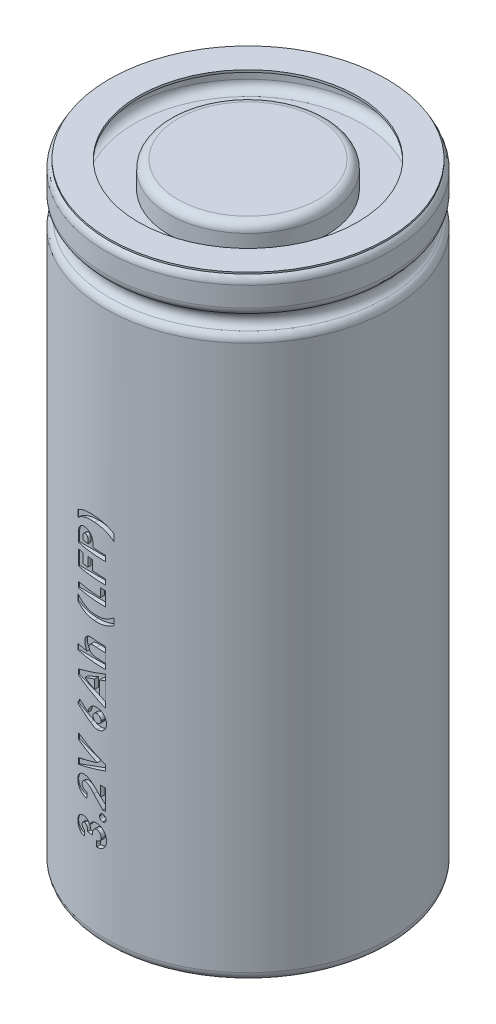
from build123d import *

# Parameters (mm, degrees)
SKETCH2_R           = 16.25
BOSS_EXTRUDE1_DEPTH = 70
SKETCH3_R           = 14
CUT_EXTRUDE1_DEPTH  = 3
SKETCH4_R           = 9
BOSS_EXTRUDE2_DEPTH = 3
SKETCH5_R           = 1
FILLET1_R           = 1
SKETCH6_R           = 15.833163787
SKETCH6_R_2         = 12.5
BOSS_EXTRUDE3_DEPTH = 0.25
CUT_EXTRUDE2_DEPTH  = 0.5


with BuildPart() as part:
    # Sketch2 → Boss-Extrude1 (new body)
    with BuildSketch(Plane(origin=(0, 0, 0), x_dir=(1, 0, 0), z_dir=(0, 1, 0))):
        Circle(SKETCH2_R)
    extrude(amount=BOSS_EXTRUDE1_DEPTH)

    # Sketch3 → Cut-Extrude1 (cut)
    with BuildSketch(Plane(origin=(0, 70, 0), x_dir=(1, 0, 0), z_dir=(0, 1, 0))):
        Circle(SKETCH3_R)
    extrude(amount=-CUT_EXTRUDE1_DEPTH, mode=Mode.SUBTRACT)

    # Sketch4 → Boss-Extrude2 (add)
    with BuildSketch(Plane(origin=(0, 67, 0), x_dir=(1, 0, 0), z_dir=(0, 1, 0))):
        Circle(SKETCH4_R)
    extrude(amount=BOSS_EXTRUDE2_DEPTH)

    # Sketch5 → Cut-Revolve1 (revolve, cut)
    with BuildSketch(Plane.XY):
        with Locations((16.25, 65)):
            Circle(SKETCH5_R)
    revolve(axis=Axis((0, 0, 0), (0, 1, 0)), mode=Mode.SUBTRACT)

    # Fillet1
    fillet1_edges = [part.edges().sort_by_distance(p)[0] for p in [
        (-16.25, 0, 0),
        (-16.25, 66, 0),
        (-16.25, 64, 0),
        (-16.25, 70, 0),
        (-14, 70, 0),
        (-14, 67, 0),
        (-9, 70, 0),
    ]]
    fillet(fillet1_edges, radius=FILLET1_R)

    # Sketch6 → Boss-Extrude3 (add)
    with BuildSketch(Plane(origin=(0, 70, 0), x_dir=(1, 0, 0), z_dir=(0, 1, 0))):
        Circle(SKETCH6_R)
        Circle(SKETCH6_R_2, mode=Mode.SUBTRACT)
    extrude(amount=-BOSS_EXTRUDE3_DEPTH)

    # Sketch7 → Cut-Extrude2 (cut)
    # profile 1 of 12: a face of its own
    with BuildSketch(Plane.XY.offset(16.25)):
        with BuildLine():
            Line((-2.647435897, 10.331764759), (-2.647435897, 9.70355963))
            add(Edge.make_bspline(
                [(-2.647435897, 9.70355963), (-2.678844503, 9.707967329), (-2.740193281, 9.716576654), (-2.829223497, 9.737740743), (-2.913884665, 9.762215728), (-2.993722434, 9.793515773), (-3.068650739, 9.829646028), (-3.138736631, 9.871778809), (-3.2049859, 9.917959128), (-3.244687038, 9.95411543), (-3.264423077, 9.972089278)],
                knots=[0, 0, 0, 0, 1.1115466, 2.171125598, 3.205689823, 4.19946166, 5.17440286, 6.118867946, 7.064860634, 8, 8, 8, 8], degree=3))
            add(Edge.make_bspline(
                [(-3.264423077, 9.972089278), (-3.290503609, 9.997950235), (-3.341905597, 10.048919463), (-3.407745865, 10.134095021), (-3.46472614, 10.223374736), (-3.509900514, 10.318549151), (-3.546463936, 10.418137282), (-3.571023669, 10.522931086), (-3.587319269, 10.63250234), (-3.588924443, 10.707270936), (-3.58974359, 10.745426618)],
                knots=[0, 0, 0, 0, 1.01925491, 2.00884431, 2.983262333, 3.955970413, 4.92937149, 5.924503185, 6.940838805, 8, 8, 8, 8], degree=3))
            add(Edge.make_bspline(
                [(-3.58974359, 10.745426618), (-3.588942749, 10.779348982), (-3.587368458, 10.846033514), (-3.574730903, 10.944042998), (-3.552566039, 11.037486839), (-3.523585976, 11.127352765), (-3.484153758, 11.212319142), (-3.438381345, 11.294261259), (-3.382239579, 11.370889653), (-3.318805033, 11.442383617), (-3.250194362, 11.508064459), (-3.176855197, 11.564944355), (-3.100746596, 11.613845023), (-3.021236241, 11.654132706), (-2.93818959, 11.685108459), (-2.852086394, 11.70660655), (-2.763116644, 11.720677572), (-2.702645104, 11.722079414), (-2.67197516, 11.7227904)],
                knots=[0, 0, 0, 0, 1.091422571, 2.145516843, 3.172569842, 4.178562979, 5.178154469, 6.181868002, 7.194278174, 8.227918432, 9.254613415, 10.245994977, 11.209837596, 12.161663635, 13.10878368, 14.055455738, 15.013766427, 16, 16, 16, 16], degree=3))
            add(Edge.make_bspline(
                [(-2.67197516, 11.7227904), (-2.633999732, 11.721303323), (-2.559008771, 11.718366757), (-2.449469875, 11.695142833), (-2.344969024, 11.657809051), (-2.246744405, 11.604725945), (-2.15489834, 11.538065162), (-2.072638599, 11.456318343), (-1.998691244, 11.36176672), (-1.958951428, 11.29078753), (-1.938601763, 11.254441041)],
                knots=[0, 0, 0, 0, 0.992776698, 1.96045919, 2.915875678, 3.886951799, 4.871409521, 5.874469288, 6.911574252, 8, 8, 8, 8], degree=3))
            add(Edge.make_bspline(
                [(-1.938601763, 11.254441041), (-1.930411961, 11.279389646), (-1.914319367, 11.328412536), (-1.882605609, 11.39807863), (-1.848021373, 11.46437765), (-1.807647976, 11.525793361), (-1.764283796, 11.584009944), (-1.715597271, 11.637185504), (-1.662838105, 11.686697005), (-1.605445041, 11.731319594), (-1.544372318, 11.771214257), (-1.480717627, 11.806373034), (-1.414248322, 11.835877856), (-1.34545286, 11.860641105), (-1.273654181, 11.879534778), (-1.199095601, 11.892827162), (-1.121956766, 11.900512989), (-1.069694892, 11.901684976), (-1.043269231, 11.902277579)],
                knots=[0, 0, 0, 0, 1.059375415, 2.081625174, 3.086260357, 4.075579879, 5.045586876, 6.014170127, 6.982201689, 7.963705737, 8.945119069, 9.924852636, 10.896327119, 11.878239286, 12.873838556, 13.889973282, 14.933087432, 16, 16, 16, 16], degree=3))
            add(Edge.make_bspline(
                [(-1.043269231, 11.902277579), (-1.004434271, 11.901076195), (-0.92785964, 11.898707309), (-0.815073255, 11.883646672), (-0.707540646, 11.855607571), (-0.604028325, 11.818716971), (-0.505858383, 11.769522424), (-0.410832012, 11.71157907), (-0.3221718, 11.640654605), (-0.238176278, 11.561119469), (-0.161438786, 11.473252222), (-0.093640361, 11.378701365), (-0.037751313, 11.277283708), (0.010019161, 11.171451142), (0.045472364, 11.058819489), (0.071435226, 10.940845723), (0.087231821, 10.816668355), (0.088894465, 10.73191824), (0.08974359, 10.688635752)],
                knots=[0, 0, 0, 0, 1.005228408, 1.982105694, 2.937129188, 3.876607107, 4.82066901, 5.774063015, 6.75178259, 7.752926466, 8.764612432, 9.766578198, 10.757677051, 11.756882247, 12.76686714, 13.807379907, 14.880213281, 16, 16, 16, 16], degree=3))
            add(Edge.make_bspline(
                [(0.08974359, 10.688635752), (0.08885038, 10.647690345), (0.087103827, 10.56762702), (0.071986526, 10.45051765), (0.047601092, 10.339216279), (0.013227802, 10.233438864), (-0.031348482, 10.13359465), (-0.084428835, 10.038778209), (-0.149074806, 9.950881585), (-0.222368157, 9.868925434), (-0.304599134, 9.794727791), (-0.393862899, 9.728412572), (-0.490498884, 9.671442039), (-0.594094222, 9.623582554), (-0.704830648, 9.58520827), (-0.822482976, 9.554938748), (-0.94728106, 9.533794991), (-1.033144797, 9.527355616), (-1.076923077, 9.524072451)],
                knots=[0, 0, 0, 0, 1.066544725, 2.085487077, 3.070979577, 4.031932826, 4.977951092, 5.916076795, 6.857635327, 7.814973522, 8.776389752, 9.738577119, 10.707772778, 11.69409279, 12.707140348, 13.757286496, 14.856535458, 16, 16, 16, 16], degree=3))
            Line((-1.076923077, 9.524072451), (-1.076923077, 10.152277579))
            add(Edge.make_bspline(
                [(-1.076923077, 10.152277579), (-1.05491115, 10.156259226), (-1.01203715, 10.164014527), (-0.949959025, 10.179127089), (-0.892679631, 10.198872662), (-0.839778149, 10.22144771), (-0.790711669, 10.246407075), (-0.746792316, 10.27622919), (-0.706294056, 10.308205114), (-0.659744034, 10.356272213), (-0.610926493, 10.423336828), (-0.567691443, 10.514138374), (-0.543102042, 10.61560728), (-0.540042771, 10.686400241), (-0.538461538, 10.72299072)],
                knots=[0, 0, 0, 0, 0.928450228, 1.808400301, 2.64896863, 3.43999153, 4.194978884, 4.9294959, 5.640047715, 6.332896648, 7.70085756, 9.063442004, 10.482192841, 12, 12, 12, 12], degree=3))
            add(Edge.make_bspline(
                [(-0.538461538, 10.72299072), (-0.538796396, 10.742409609), (-0.539452308, 10.780446868), (-0.546656211, 10.8363322), (-0.558658843, 10.889516309), (-0.574527901, 10.94044087), (-0.596062126, 10.988305588), (-0.621052522, 11.034194202), (-0.651644551, 11.07726751), (-0.686501264, 11.117274592), (-0.723721816, 11.154507833), (-0.764450856, 11.186300708), (-0.806732716, 11.213749086), (-0.851685764, 11.235407702), (-0.89789091, 11.253534624), (-0.946816755, 11.264840105), (-0.997401291, 11.273325055), (-1.032013112, 11.273820833), (-1.049579327, 11.274072451)],
                knots=[0, 0, 0, 0, 1.110702965, 2.175618623, 3.217100552, 4.227908035, 5.221854906, 6.215531843, 7.213608581, 8.237687243, 9.249555755, 10.220750668, 11.188994735, 12.127982202, 13.071814005, 14.022160605, 14.996205625, 16, 16, 16, 16], degree=3))
            add(Edge.make_bspline(
                [(-1.049579327, 11.274072451), (-1.068797225, 11.273432594), (-1.106825782, 11.27216644), (-1.162554813, 11.261024341), (-1.216369238, 11.244346262), (-1.267825048, 11.220360089), (-1.316619627, 11.188973115), (-1.363157092, 11.150809772), (-1.40706693, 11.105524827), (-1.449627971, 11.054634749), (-1.486885705, 10.996086214), (-1.521194506, 10.932243504), (-1.548512769, 10.8615338), (-1.572907077, 10.785653438), (-1.590725788, 10.703175688), (-1.603663478, 10.614610219), (-1.61329371, 10.520100627), (-1.614675316, 10.454953906), (-1.615384615, 10.421508348)],
                knots=[0, 0, 0, 0, 0.809868251, 1.602574917, 2.388262527, 3.182133002, 3.988875265, 4.829537611, 5.714850619, 6.646378958, 7.622533229, 8.636771727, 9.698525113, 10.814716514, 11.996253919, 13.252421425, 14.589425562, 16, 16, 16, 16], degree=3))
            Line((-1.615384615, 10.421508348), (-2.198717949, 10.421508348))
            add(Edge.make_bspline(
                [(-2.198717949, 10.421508348), (-2.202251039, 10.463155134), (-2.208860751, 10.541068021), (-2.224535371, 10.649140911), (-2.244812408, 10.740434139), (-2.271238882, 10.815991209), (-2.302106908, 10.879767843), (-2.337872694, 10.934700518), (-2.378943006, 10.98262763), (-2.425258001, 11.02204968), (-2.47380556, 11.054902156), (-2.525438422, 11.07739141), (-2.578102266, 11.092465301), (-2.614149685, 11.093882867), (-2.632011218, 11.094585272)],
                knots=[0, 0, 0, 0, 1.700711886, 3.181695139, 4.441392523, 5.500267777, 6.431839453, 7.31822765, 8.161090383, 8.990537424, 9.787217293, 10.536619396, 11.274893404, 12, 12, 12, 12], degree=3))
            add(Edge.make_bspline(
                [(-2.632011218, 11.094585272), (-2.654802911, 11.093378446), (-2.699287471, 11.091022978), (-2.76306779, 11.072370346), (-2.820223933, 11.040716058), (-2.870116588, 10.997766236), (-2.91081468, 10.945001912), (-2.941083583, 10.883936816), (-2.958741347, 10.814880377), (-2.960584974, 10.766329467), (-2.961538462, 10.741219887)],
                knots=[0, 0, 0, 0, 1.009324788, 1.969988301, 2.915956825, 3.885795408, 4.868116622, 5.850437836, 6.888288533, 8, 8, 8, 8], degree=3))
            add(Edge.make_bspline(
                [(-2.961538462, 10.741219887), (-2.960418084, 10.718458183), (-2.958194913, 10.67329199), (-2.941601749, 10.607245497), (-2.913669222, 10.544523334), (-2.875151914, 10.486424298), (-2.82889426, 10.433787062), (-2.77411167, 10.390587077), (-2.714086265, 10.354655379), (-2.669739782, 10.339424878), (-2.647435897, 10.331764759)],
                knots=[0, 0, 0, 0, 0.98818071, 1.960853194, 2.938124878, 3.957524365, 4.978590984, 5.968022688, 6.978025184, 8, 8, 8, 8], degree=3))
        make_face()
    # profile 2 of 12: a face of its own
    with BuildSketch(Plane.XY.offset(16.25)):
        with BuildLine():
            add(Edge.make_bspline(
                [(-0.717948718, 12.777277579), (-0.716650253, 12.802668763), (-0.714090444, 12.852725251), (-0.692330502, 12.924368999), (-0.656893529, 12.99003769), (-0.608734971, 13.047993127), (-0.551230625, 13.097264889), (-0.485519998, 13.132831618), (-0.41366347, 13.154990565), (-0.363576238, 13.157436145), (-0.337940705, 13.158687836)],
                knots=[0, 0, 0, 0, 1.01719242, 2.005305523, 2.97459142, 3.994072628, 5.012345306, 5.994342214, 6.97346883, 8, 8, 8, 8], degree=3))
            add(Edge.make_bspline(
                [(-0.337940705, 13.158687836), (-0.312315054, 13.157405209), (-0.262022796, 13.154887958), (-0.189821515, 13.133020543), (-0.123877738, 13.097059571), (-0.06574527, 13.048057808), (-0.016987557, 12.990048465), (0.019383821, 12.924560112), (0.040971107, 12.85270361), (0.043559056, 12.80266148), (0.044871795, 12.777277579)],
                knots=[0, 0, 0, 0, 1.023125046, 2.0079595, 2.986698053, 4.008755096, 5.030812139, 6.001348264, 6.986182718, 8, 8, 8, 8], degree=3))
            add(Edge.make_bspline(
                [(0.044871795, 12.777277579), (0.043569733, 12.751887662), (0.041002833, 12.701833671), (0.019201821, 12.629865495), (-0.016744671, 12.563893568), (-0.065804938, 12.50586997), (-0.123669443, 12.45664781), (-0.190033987, 12.42169504), (-0.261995122, 12.39961657), (-0.312305713, 12.397132859), (-0.337940705, 12.395867323)],
                knots=[0, 0, 0, 0, 1.013339287, 1.99770941, 2.975986507, 3.997561671, 5.019136834, 5.992987214, 6.977357337, 8, 8, 8, 8], degree=3))
            add(Edge.make_bspline(
                [(-0.337940705, 12.395867323), (-0.363585586, 12.397101906), (-0.413691083, 12.399514061), (-0.48530867, 12.421881744), (-0.551437708, 12.456444504), (-0.608676025, 12.505933645), (-0.657134454, 12.56390797), (-0.692148813, 12.630054181), (-0.714121929, 12.701812466), (-0.716660849, 12.751880526), (-0.717948718, 12.777277579)],
                knots=[0, 0, 0, 0, 1.026040734, 2.004699561, 2.981785884, 3.999572071, 5.018566211, 5.995652533, 6.983293555, 8, 8, 8, 8], degree=3))
        make_face()
    # profile 3 of 12: a face of its own
    with BuildSketch(Plane.XY.offset(16.25)):
        with BuildLine():
            Line((-2.333333333, 14.280482707), (-2.333333333, 13.652277579))
            add(Edge.make_bspline(
                [(-2.333333333, 13.652277579), (-2.380854225, 13.654989636), (-2.473707194, 13.660288831), (-2.608570766, 13.681390811), (-2.736033191, 13.709594084), (-2.855711269, 13.747556387), (-2.967655278, 13.794315479), (-3.071494412, 13.851035141), (-3.167972725, 13.916021924), (-3.25539818, 13.990585761), (-3.333996324, 14.071700465), (-3.402708884, 14.159158087), (-3.460230283, 14.252710191), (-3.507415349, 14.351731216), (-3.545169479, 14.455832218), (-3.570397882, 14.566064991), (-3.587486499, 14.681456875), (-3.58898158, 14.760452664), (-3.58974359, 14.800715079)],
                knots=[0, 0, 0, 0, 1.198928049, 2.342633425, 3.435730849, 4.486331048, 5.502589352, 6.488331875, 7.46361919, 8.428949135, 9.378681775, 10.305958057, 11.226249248, 12.140413166, 13.066341608, 14.010670971, 14.986082777, 16, 16, 16, 16], degree=3))
            add(Edge.make_bspline(
                [(-3.58974359, 14.800715079), (-3.588305172, 14.850158816), (-3.585495808, 14.946726991), (-3.558364005, 15.086581797), (-3.516816094, 15.217897468), (-3.456452711, 15.339277176), (-3.380333998, 15.450509889), (-3.289398207, 15.550977189), (-3.182540626, 15.638719644), (-3.06283848, 15.713052965), (-2.935837603, 15.774522704), (-2.80475327, 15.818011548), (-2.672968709, 15.846445682), (-2.58424216, 15.849485431), (-2.540164263, 15.850995528)],
                knots=[0, 0, 0, 0, 1.075374184, 2.100304875, 3.089917907, 4.066149699, 5.039978333, 6.01615708, 7.006437042, 8.039858286, 9.077679641, 10.07047942, 11.041445745, 12, 12, 12, 12], degree=3))
            add(Edge.make_bspline(
                [(-2.540164263, 15.850995528), (-2.513502321, 15.85040833), (-2.459838418, 15.849226445), (-2.37863176, 15.841008645), (-2.295913288, 15.828680317), (-2.211753913, 15.810092218), (-2.126130087, 15.786911281), (-2.038785397, 15.758789663), (-1.95021573, 15.725074059), (-1.859421581, 15.68633101), (-1.766118882, 15.640097409), (-1.66886483, 15.586318459), (-1.567762959, 15.523196208), (-1.461821602, 15.452785476), (-1.352658361, 15.372316287), (-1.239061065, 15.283920193), (-1.12120871, 15.187152231), (-1.042395337, 15.118525711), (-1.001903045, 15.083267163)],
                knots=[0, 0, 0, 0, 0.728277616, 1.465842947, 2.227925269, 3.011838508, 3.818735656, 4.650581052, 5.517389122, 6.406849312, 7.346234817, 8.360743166, 9.441530624, 10.601362564, 11.834937575, 13.145232671, 14.533293658, 16, 16, 16, 16], degree=3))
            Line((-1.001903045, 15.083267163), (-0.583333333, 14.717982707))
            Line((-0.583333333, 14.717982707), (-0.583333333, 15.895867323))
            Line((-0.583333333, 15.895867323), (0, 15.895867323))
            Line((0, 15.895867323), (0, 13.562533989))
            Line((0, 13.562533989), (-0.318309295, 13.562533989))
            Line((-0.318309295, 13.562533989), (-1.421173878, 14.598792002))
            add(Edge.make_bspline(
                [(-1.421173878, 14.598792002), (-1.45334446, 14.62879481), (-1.515649338, 14.686901351), (-1.607155907, 14.769573254), (-1.693974712, 14.844411556), (-1.777112566, 14.909742882), (-1.853754527, 14.969519966), (-1.926797956, 15.019527893), (-1.99418582, 15.06307867), (-2.076328946, 15.108572058), (-2.173559297, 15.152770088), (-2.285503417, 15.193298977), (-2.392571242, 15.217756494), (-2.462463844, 15.221158397), (-2.49599359, 15.2227904)],
                knots=[0, 0, 0, 0, 1.246192343, 2.413505005, 3.49357156, 4.492416076, 5.408771964, 6.246246772, 6.999304986, 7.680960093, 8.904522682, 10.020616941, 11.0504258, 12, 12, 12, 12], degree=3))
            add(Edge.make_bspline(
                [(-2.49599359, 15.2227904), (-2.528432191, 15.221573411), (-2.591287182, 15.219215299), (-2.680698073, 15.193301566), (-2.761650506, 15.153155112), (-2.831725534, 15.096583087), (-2.889310831, 15.028056648), (-2.932141156, 14.94886791), (-2.956854058, 14.859662496), (-2.959947231, 14.7971278), (-2.961538462, 14.764957868)],
                knots=[0, 0, 0, 0, 1.062038974, 2.057870785, 3.028805853, 4.01125022, 4.991535629, 5.949134679, 6.94496649, 8, 8, 8, 8], degree=3))
            add(Edge.make_bspline(
                [(-2.961538462, 14.764957868), (-2.960950642, 14.748338471), (-2.959793424, 14.715620519), (-2.952090139, 14.667527687), (-2.938513903, 14.621763902), (-2.920323658, 14.577819788), (-2.896212358, 14.536164328), (-2.866491338, 14.49690259), (-2.831915879, 14.459620902), (-2.792594092, 14.424490253), (-2.748710967, 14.392516776), (-2.700667285, 14.364118051), (-2.64849287, 14.340637033), (-2.592876502, 14.319963492), (-2.533220817, 14.304019067), (-2.469882848, 14.292409548), (-2.402965636, 14.283583606), (-2.356966346, 14.281535144), (-2.333333333, 14.280482707)],
                knots=[0, 0, 0, 0, 0.903469896, 1.778625579, 2.63899355, 3.493148037, 4.358286772, 5.247621495, 6.164656832, 7.118446693, 8.109501108, 9.111810964, 10.146451449, 11.215617525, 12.33435995, 13.498009769, 14.714554818, 16, 16, 16, 16], degree=3))
        make_face()
    # profile 4 of 12: a face of its own
    with BuildSketch(Plane.XY.offset(16.25)):
        Polygon((-3.5, 16.322149374), (-3.5, 16.993122932), (-1.013822115, 17.892662195), (-3.5, 18.794304823), (-3.5, 19.463175015), (0, 18.194144566), (0, 17.589076457), align=None)
    # profile 5 of 12: a face of its own
    with BuildSketch(Plane.XY.offset(16.25)):
        with BuildLine():
            Line((-3.58974359, 22.343383348), (-3.307892628, 22.899372932))
            Line((-3.307892628, 22.899372932), (-2.108974359, 22.28939697))
            add(Edge.make_bspline(
                [(-2.108974359, 22.28939697), (-2.108048145, 22.32543642), (-2.106223816, 22.396422027), (-2.091273634, 22.500817411), (-2.065936314, 22.600874792), (-2.030576693, 22.696590035), (-1.986153018, 22.788646719), (-1.931481503, 22.87659795), (-1.86526531, 22.959272649), (-1.791766129, 23.03821321), (-1.710377004, 23.110008209), (-1.622911973, 23.172371027), (-1.531510742, 23.226720129), (-1.434125355, 23.26896869), (-1.332370898, 23.303047854), (-1.225840394, 23.327637453), (-1.114225415, 23.341666511), (-1.038400302, 23.343600651), (-0.999799679, 23.344585272)],
                knots=[0, 0, 0, 0, 1.013301021, 1.995862538, 2.958769729, 3.911210226, 4.860765807, 5.829243184, 6.816804824, 7.835209597, 8.859810738, 9.863084768, 10.852896952, 11.844649668, 12.842374562, 13.8676291, 14.914464604, 16, 16, 16, 16], degree=3))
            add(Edge.make_bspline(
                [(-0.999799679, 23.344585272), (-0.962592079, 23.343659782), (-0.889048608, 23.341830485), (-0.781013621, 23.326795636), (-0.677215804, 23.302233246), (-0.577961777, 23.267922484), (-0.483258335, 23.223101172), (-0.392589309, 23.169229182), (-0.306658059, 23.104749405), (-0.225999088, 23.031669628), (-0.152483585, 22.951765938), (-0.087137228, 22.867546948), (-0.033159024, 22.778294345), (0.012426931, 22.685696303), (0.046443906, 22.588047724), (0.072120836, 22.486810004), (0.086937537, 22.381215408), (0.088800754, 22.309540502), (0.08974359, 22.273271169)],
                knots=[0, 0, 0, 0, 1.049918105, 2.075237872, 3.072085611, 4.056810501, 5.033614955, 6.024683311, 7.028730171, 8.060902963, 9.092654048, 10.090156417, 11.064284078, 12.032024683, 12.998077465, 13.977262554, 14.976443176, 16, 16, 16, 16], degree=3))
            add(Edge.make_bspline(
                [(0.08974359, 22.273271169), (0.088962962, 22.235347152), (0.087427962, 22.160774705), (0.070489961, 22.051610594), (0.044503734, 21.947167031), (0.009209971, 21.847018513), (-0.038694064, 21.752412519), (-0.096096067, 21.662541661), (-0.164318672, 21.577764891), (-0.241319005, 21.498634538), (-0.325698602, 21.427358504), (-0.41329732, 21.363782399), (-0.504263946, 21.309997883), (-0.598498296, 21.266460334), (-0.695700846, 21.232491389), (-0.796055878, 21.208855917), (-0.899297254, 21.193455229), (-0.969362693, 21.19164985), (-1.004707532, 21.190739118)],
                knots=[0, 0, 0, 0, 1.063729824, 2.091680771, 3.092458079, 4.082252707, 5.065066109, 6.062289472, 7.070414589, 8.114214813, 9.156632944, 10.167081891, 11.149282074, 12.117871028, 13.076366051, 14.034232288, 15.008359245, 16, 16, 16, 16], degree=3))
            add(Edge.make_bspline(
                [(-1.004707532, 21.190739118), (-1.032077983, 21.191220314), (-1.086971239, 21.192185384), (-1.169170777, 21.201884367), (-1.251586612, 21.21662883), (-1.321129985, 21.233724006), (-1.379940422, 21.251316191), (-1.429695831, 21.269058065), (-1.484778053, 21.290806696), (-1.54538714, 21.316436915), (-1.612000557, 21.344885743), (-1.683837124, 21.377957004), (-1.761469825, 21.414573711), (-1.814772946, 21.440730936), (-1.842548077, 21.454360913)],
                knots=[0, 0, 0, 0, 1.110459156, 2.227099586, 3.354645278, 4.50724841, 5.131424341, 5.845429508, 6.650417918, 7.534765369, 8.5162346, 9.590157747, 10.744282107, 12, 12, 12, 12], degree=3))
            Line((-1.842548077, 21.454360913), (-3.58974359, 22.343383348))
        make_face()
        with BuildLine():
            add(Edge.make_bspline(
                [(-1.525641026, 22.259248733), (-1.524255618, 22.229108039), (-1.521544556, 22.170126656), (-1.493250213, 22.086221541), (-1.448728493, 22.010024116), (-1.387579467, 21.943284857), (-1.313420818, 21.887873969), (-1.228668225, 21.847470726), (-1.134858814, 21.822776348), (-1.069366025, 21.820248954), (-1.035556891, 21.818944246)],
                knots=[0, 0, 0, 0, 0.981531227, 1.92072777, 2.858278205, 3.847411092, 4.856727683, 5.864107753, 6.897395173, 8, 8, 8, 8], degree=3))
            add(Edge.make_bspline(
                [(-1.035556891, 21.818944246), (-1.001744589, 21.820510086), (-0.935977402, 21.823555749), (-0.841574321, 21.848797495), (-0.755654275, 21.890775962), (-0.680875852, 21.949193958), (-0.617897902, 22.017291275), (-0.571952081, 22.093573516), (-0.543645634, 22.175750101), (-0.540201502, 22.232621071), (-0.538461538, 22.261352098)],
                knots=[0, 0, 0, 0, 1.098517379, 2.136689732, 3.153260427, 4.188757218, 5.205896274, 6.153740673, 7.067275863, 8, 8, 8, 8], degree=3))
            add(Edge.make_bspline(
                [(-0.538461538, 22.261352098), (-0.540235151, 22.291692787), (-0.543713513, 22.351196146), (-0.570791831, 22.437036265), (-0.616040201, 22.5154412), (-0.678046867, 22.584807682), (-0.752042934, 22.644101352), (-0.838605768, 22.685860213), (-0.934009126, 22.712026627), (-1.001025749, 22.714899738), (-1.035556891, 22.716380143)],
                knots=[0, 0, 0, 0, 0.969156912, 1.90068503, 2.84824055, 3.843957741, 4.860802806, 5.860356532, 6.897522282, 8, 8, 8, 8], degree=3))
            add(Edge.make_bspline(
                [(-1.035556891, 22.716380143), (-1.069346543, 22.714746657), (-1.134784149, 22.711583219), (-1.22902784, 22.68748922), (-1.313463746, 22.645149447), (-1.387889648, 22.588476852), (-1.448997728, 22.519459796), (-1.493602865, 22.440202647), (-1.521493736, 22.352464997), (-1.52423844, 22.290773854), (-1.525641026, 22.259248733)],
                knots=[0, 0, 0, 0, 1.082993585, 2.097343529, 3.092828129, 4.092676255, 5.080456977, 6.026823306, 6.991676418, 8, 8, 8, 8], degree=3))
        make_face(mode=Mode.SUBTRACT)
    # profile 6 of 12: a face of its own
    with BuildSketch(Plane.XY.offset(16.25)):
        Polygon((-3.5, 25.185029983), (-3.5, 25.767662195), (0, 27.181123733), (0, 26.510150175), (-0.717948718, 26.238114919), (-0.717948718, 24.713175015), (0, 24.441139759), (0, 23.770867323), align=None)
        Polygon((-2.561197917, 25.475995528), (-1.346153846, 24.951556425), (-1.346153846, 26.00043463), align=None, mode=Mode.SUBTRACT)
    # profile 7 of 12: a face of its own
    with BuildSketch(Plane.XY.offset(16.25)):
        with BuildLine():
            Line((-3.58974359, 27.607405784), (-3.58974359, 28.235610913))
            Line((-3.58974359, 28.235610913), (-2.280749199, 28.235610913))
            add(Edge.make_bspline(
                [(-2.280749199, 28.235610913), (-2.306478695, 28.267257522), (-2.356629942, 28.328942247), (-2.422051954, 28.425683842), (-2.477604623, 28.522474746), (-2.523750552, 28.619522121), (-2.55924684, 28.71740221), (-2.583274454, 28.815979887), (-2.600017344, 28.914897853), (-2.601714278, 28.981302006), (-2.602564103, 29.014557227)],
                knots=[0, 0, 0, 0, 1.136941991, 2.216096947, 3.252425353, 4.246581915, 5.209309128, 6.149808324, 7.073423436, 8, 8, 8, 8], degree=3))
            add(Edge.make_bspline(
                [(-2.602564103, 29.014557227), (-2.601719816, 29.046376045), (-2.600062412, 29.108839057), (-2.588090744, 29.200476082), (-2.56749059, 29.288246052), (-2.539172108, 29.372365185), (-2.50108792, 29.452254756), (-2.456477103, 29.52895364), (-2.403029172, 29.601550169), (-2.361828899, 29.645721022), (-2.341045673, 29.668002739)],
                knots=[0, 0, 0, 0, 1.056403236, 2.073808271, 3.062028718, 4.046096703, 5.014652014, 5.995532726, 6.988858718, 8, 8, 8, 8], degree=3))
            add(Edge.make_bspline(
                [(-2.341045673, 29.668002739), (-2.321625652, 29.686301911), (-2.282503844, 29.723165757), (-2.215058751, 29.769078694), (-2.141594309, 29.808724056), (-2.061420177, 29.841029374), (-1.974499035, 29.865055336), (-1.881546953, 29.883656303), (-1.781548999, 29.893943033), (-1.712629167, 29.895212557), (-1.677083333, 29.895867323)],
                knots=[0, 0, 0, 0, 0.887296576, 1.787466942, 2.706642908, 3.663267187, 4.658426068, 5.705361056, 6.816525637, 8, 8, 8, 8], degree=3))
            Line((-1.677083333, 29.895867323), (0, 29.895867323))
            Line((0, 29.895867323), (0, 29.267662195))
            Line((0, 29.267662195), (-1.111979167, 29.267662195))
            add(Edge.make_bspline(
                [(-1.111979167, 29.267662195), (-1.14727009, 29.267541015), (-1.214820559, 29.267309065), (-1.311823826, 29.265199487), (-1.399717902, 29.261820207), (-1.478980769, 29.257021039), (-1.549078172, 29.250600017), (-1.610712396, 29.244115057), (-1.663143829, 29.235093534), (-1.720106439, 29.221563911), (-1.78108043, 29.199612892), (-1.846046854, 29.167366905), (-1.900283937, 29.125143946), (-1.944433647, 29.075411309), (-1.978441861, 29.018485197), (-2.002268624, 28.955323826), (-2.016559506, 28.885951641), (-2.018317091, 28.837711646), (-2.019230769, 28.81263415)],
                knots=[0, 0, 0, 0, 1.461086369, 2.796670045, 4.016787492, 5.10259795, 6.083731707, 6.931073812, 7.667583839, 8.284794279, 9.35287035, 10.343878355, 11.274824484, 12.179607611, 13.082318872, 14.004169564, 14.962470221, 16, 16, 16, 16], degree=3))
            add(Edge.make_bspline(
                [(-2.019230769, 28.81263415), (-2.017954086, 28.779976812), (-2.015453559, 28.716013735), (-1.98971362, 28.624287852), (-1.94902838, 28.539682793), (-1.892640467, 28.463185976), (-1.82201236, 28.396527118), (-1.739229166, 28.340677283), (-1.645118896, 28.294995175), (-1.57649206, 28.275250546), (-1.541065705, 28.265058028)],
                knots=[0, 0, 0, 0, 0.993549393, 1.945978497, 2.879753144, 3.843180486, 4.826017097, 5.826060929, 6.877775219, 8, 8, 8, 8], degree=3))
            add(Edge.make_bspline(
                [(-1.541065705, 28.265058028), (-1.530115934, 28.262520069), (-1.505146874, 28.256732693), (-1.462545368, 28.252300611), (-1.411047447, 28.245723471), (-1.350344508, 28.243441967), (-1.28053018, 28.239168169), (-1.201491506, 28.237631143), (-1.11315418, 28.236083749), (-1.051216492, 28.235773591), (-1.018729968, 28.235610913)],
                knots=[0, 0, 0, 0, 0.514379255, 1.17295301, 1.959069106, 2.891908278, 3.953016936, 5.163065833, 6.51201855, 8, 8, 8, 8], degree=3))
            Line((-1.018729968, 28.235610913), (0, 28.235610913))
            Line((0, 28.235610913), (0, 27.607405784))
            Line((0, 27.607405784), (-3.58974359, 27.607405784))
        make_face()
    # profile 8 of 12: a face of its own
    with BuildSketch(Plane.XY.offset(16.25)):
        with BuildLine():
            Line((-3.58974359, 32.431824855), (-3.58974359, 33.216380143))
            add(Edge.make_bspline(
                [(-3.58974359, 33.216380143), (-3.551052405, 33.183013901), (-3.474228064, 33.116762644), (-3.353830311, 33.02535535), (-3.231776469, 32.939340677), (-3.106917706, 32.860280912), (-2.979782663, 32.787070711), (-2.850242845, 32.720438066), (-2.717948603, 32.66074178), (-2.582997424, 32.607263266), (-2.444297586, 32.560036736), (-2.301059599, 32.519425458), (-2.152938972, 32.485095951), (-1.999918648, 32.45712669), (-1.842238164, 32.435413517), (-1.679643463, 32.42036081), (-1.512457591, 32.409869031), (-1.399222052, 32.409084602), (-1.341947115, 32.408687836)],
                knots=[0, 0, 0, 0, 1.002328845, 1.990201486, 2.964763713, 3.931667243, 4.88899637, 5.842726853, 6.788918985, 7.735899855, 8.69015943, 9.662777499, 10.656169973, 11.672604641, 12.714198798, 13.7783548, 14.876283995, 16, 16, 16, 16], degree=3))
            add(Edge.make_bspline(
                [(-1.341947115, 32.408687836), (-1.280000399, 32.409347663), (-1.157885524, 32.410648373), (-0.977528287, 32.421343081), (-0.802861577, 32.439032071), (-0.633551892, 32.462265177), (-0.470385808, 32.494204443), (-0.312502899, 32.531804691), (-0.160603577, 32.57709587), (-0.062461946, 32.613148863), (-0.014022436, 32.630943445)],
                knots=[0, 0, 0, 0, 1.097990858, 2.164457195, 3.201156713, 4.209415668, 5.192484095, 6.147015238, 7.085427113, 8, 8, 8, 8], degree=3))
            add(Edge.make_bspline(
                [(-0.014022436, 32.630943445), (0.023310584, 32.646207911), (0.099547503, 32.677379135), (0.213206978, 32.732776294), (0.329384312, 32.795098704), (0.447836054, 32.8647459), (0.568926312, 32.941055001), (0.691211527, 33.026507893), (0.816848495, 33.11794652), (0.899972292, 33.183164349), (0.942307692, 33.216380143)],
                knots=[0, 0, 0, 0, 0.860019026, 1.756225466, 2.695066549, 3.671335017, 4.686319673, 5.746805091, 6.852435615, 8, 8, 8, 8], degree=3))
            Line((0.942307692, 33.216380143), (0.942307692, 32.431824855))
            add(Edge.make_bspline(
                [(0.942307692, 32.431824855), (0.893908214, 32.402248327), (0.798899966, 32.344189559), (0.654956695, 32.264635332), (0.514821168, 32.189804775), (0.376030563, 32.123433017), (0.240396082, 32.062458525), (0.105866373, 32.010455872), (-0.025333409, 31.962815213), (-0.156053302, 31.923337343), (-0.288224797, 31.889276577), (-0.424558, 31.85986913), (-0.56682715, 31.835518051), (-0.714574769, 31.815049058), (-0.868266015, 31.799927529), (-1.027483269, 31.788821269), (-1.192304991, 31.781452221), (-1.304078465, 31.780809376), (-1.360877404, 31.780482707)],
                knots=[0, 0, 0, 0, 1.119882576, 2.198331145, 3.246994034, 4.256302108, 5.235602697, 6.182553443, 7.10359008, 7.991173752, 8.877653015, 9.798180817, 10.744265315, 11.727147571, 12.742881309, 13.793045941, 14.878511653, 16, 16, 16, 16], degree=3))
            add(Edge.make_bspline(
                [(-1.360877404, 31.780482707), (-1.416510193, 31.780749195), (-1.526196406, 31.781274605), (-1.687976111, 31.789534568), (-1.844611879, 31.801394595), (-1.996272232, 31.816980503), (-2.142552776, 31.839123294), (-2.28369785, 31.864665715), (-2.419345345, 31.895669573), (-2.550669836, 31.93141859), (-2.679498108, 31.973703693), (-2.808375982, 32.020262763), (-2.937487681, 32.07365405), (-3.066684893, 32.133821729), (-3.197190013, 32.198770369), (-3.328183388, 32.270282633), (-3.459393108, 32.348274768), (-3.545963216, 32.403763171), (-3.58974359, 32.431824855)],
                knots=[0, 0, 0, 0, 1.13124884, 2.230382506, 3.293325202, 4.325726805, 5.329922863, 6.301279984, 7.242100146, 8.158744037, 9.068064357, 9.998745815, 10.944916929, 11.908229425, 12.896588244, 13.908972629, 14.942522287, 16, 16, 16, 16], degree=3))
        make_face()
    # profile 9 of 12: a face of its own
    with BuildSketch(Plane.XY.offset(16.25)):
        Polygon((-3.5, 33.799713477), (-3.5, 34.427918605), (-0.628205128, 34.427918605), (-0.628205128, 35.415098092), (0, 35.415098092), (0, 33.799713477), align=None)
    # profile 10 of 12: a face of its own
    with BuildSketch(Plane.XY.offset(16.25)):
        Polygon((-3.5, 35.95355963), (-3.5, 37.658687836), (-2.871794872, 37.658687836), (-2.871794872, 36.581764759), (-2.198717949, 36.581764759), (-2.198717949, 37.658687836), (-1.570512821, 37.658687836), (-1.570512821, 36.581764759), (0, 36.581764759), (0, 35.95355963), align=None)
    # profile 11 of 12: a face of its own
    with BuildSketch(Plane.XY.offset(16.25)):
        with BuildLine():
            Line((-3.5, 38.286892964), (-3.5, 38.988014759))
            add(Edge.make_bspline(
                [(-3.5, 38.988014759), (-3.499794943, 39.033825147), (-3.499399346, 39.12220299), (-3.494602189, 39.249651105), (-3.486005415, 39.367228248), (-3.475381092, 39.474907334), (-3.460486444, 39.57264432), (-3.443410161, 39.660560854), (-3.422608679, 39.738677581), (-3.397909955, 39.807867666), (-3.368816596, 39.869982684), (-3.337741666, 39.928694458), (-3.300907148, 39.983119337), (-3.260968146, 40.034535061), (-3.217093764, 40.082552698), (-3.169457403, 40.127528066), (-3.117366769, 40.168998044), (-3.061180718, 40.206702642), (-3.002043161, 40.240925315), (-2.939819237, 40.270819556), (-2.874418408, 40.29506936), (-2.806261602, 40.315411573), (-2.735352377, 40.331750733), (-2.661254472, 40.342626574), (-2.584485312, 40.350014), (-2.532236172, 40.350665838), (-2.505809295, 40.350995528)],
                knots=[0, 0, 0, 0, 1.698787518, 3.27731721, 4.728409951, 6.070286353, 7.288646904, 8.393455548, 9.389990496, 10.283725379, 11.113616976, 11.931887102, 12.744353494, 13.547053751, 14.344590688, 15.153907614, 15.974148981, 16.810666655, 17.660988447, 18.506082349, 19.367288142, 20.244738011, 21.142497992, 22.06302001, 23.020302899, 24, 24, 24, 24], degree=3))
            add(Edge.make_bspline(
                [(-2.505809295, 40.350995528), (-2.476573871, 40.350518507), (-2.41912267, 40.349581102), (-2.334906255, 40.340391517), (-2.254613538, 40.324692795), (-2.177567349, 40.304175413), (-2.105035443, 40.275565284), (-2.035286545, 40.242879896), (-1.970278542, 40.202665217), (-1.909189497, 40.156718215), (-1.851555454, 40.106521462), (-1.798919051, 40.050964308), (-1.751296008, 39.990701135), (-1.706626877, 39.927405539), (-1.668488305, 39.85846939), (-1.63291327, 39.786305901), (-1.602769505, 39.709098363), (-1.586947814, 39.655375984), (-1.578926282, 39.628138957)],
                knots=[0, 0, 0, 0, 1.101964615, 2.165495883, 3.188506962, 4.184641065, 5.166448333, 6.124117473, 7.085225874, 8.042124548, 9.003636759, 9.963451826, 10.9225791, 11.897800977, 12.880319672, 13.889154746, 14.929810112, 16, 16, 16, 16], degree=3))
            add(Edge.make_bspline(
                [(-1.578926282, 39.628138957), (-1.574462228, 39.610196736), (-1.564791651, 39.571328108), (-1.554973587, 39.507011204), (-1.545946482, 39.432892726), (-1.538188777, 39.348732998), (-1.532915346, 39.254483503), (-1.52879703, 39.150235497), (-1.52580259, 39.035941737), (-1.525696334, 38.956466376), (-1.525641026, 38.915098092)],
                knots=[0, 0, 0, 0, 0.618981996, 1.340914327, 2.176866532, 3.120127938, 4.170906482, 5.338178032, 6.614476169, 8, 8, 8, 8], degree=3))
            Line((-1.525641026, 38.915098092), (0, 38.915098092))
            Line((0, 38.915098092), (0, 38.286892964))
            Line((0, 38.286892964), (-3.5, 38.286892964))
        make_face()
        with BuildLine():
            Line((-2.153846154, 38.915098092), (-2.153846154, 39.137353701))
            add(Edge.make_bspline(
                [(-2.153846154, 39.137353701), (-2.154102552, 39.177796666), (-2.154574328, 39.252212322), (-2.16139806, 39.353837163), (-2.171817258, 39.435506787), (-2.186766075, 39.500022155), (-2.209437711, 39.55097787), (-2.235710422, 39.594874144), (-2.268882666, 39.632837847), (-2.307426222, 39.665011777), (-2.350844815, 39.691155943), (-2.39902211, 39.709533637), (-2.451271104, 39.721122603), (-2.487750451, 39.722223995), (-2.506510417, 39.7227904)],
                knots=[0, 0, 0, 0, 1.862197296, 3.426470689, 4.686743892, 5.65255712, 6.462325617, 7.244961981, 8.000258385, 8.771939908, 9.549006364, 10.32248703, 11.137317743, 12, 12, 12, 12], degree=3))
            add(Edge.make_bspline(
                [(-2.506510417, 39.7227904), (-2.5229051, 39.72224188), (-2.554714727, 39.721177619), (-2.60059162, 39.713251521), (-2.643274469, 39.700949813), (-2.682168289, 39.682149038), (-2.718180241, 39.659323184), (-2.750189266, 39.63036575), (-2.779230963, 39.596971876), (-2.794583834, 39.571147019), (-2.802383814, 39.558026778)],
                knots=[0, 0, 0, 0, 1.102449765, 2.139017612, 3.12397484, 4.080535277, 5.035673127, 5.982361139, 6.974944601, 8, 8, 8, 8], degree=3))
            add(Edge.make_bspline(
                [(-2.802383814, 39.558026778), (-2.808002861, 39.546915984), (-2.819899535, 39.523392158), (-2.833730288, 39.4833288), (-2.845398051, 39.437096298), (-2.855082183, 39.384382528), (-2.862598074, 39.325397782), (-2.868345851, 39.260152584), (-2.870657256, 39.188550918), (-2.871405207, 39.138756244), (-2.871794872, 39.112814438)],
                knots=[0, 0, 0, 0, 0.656809284, 1.390599849, 2.23162475, 3.173112763, 4.218524733, 5.370385145, 6.63003504, 8, 8, 8, 8], degree=3))
            Line((-2.871794872, 39.112814438), (-2.871794872, 38.915098092))
            Line((-2.871794872, 38.915098092), (-2.153846154, 38.915098092))
        make_face(mode=Mode.SUBTRACT)
    # profile 12 of 12: a face of its own
    with BuildSketch(Plane.XY.offset(16.25)):
        with BuildLine():
            Line((0.942307692, 41.494525175), (0.942307692, 40.709969887))
            add(Edge.make_bspline(
                [(0.942307692, 40.709969887), (0.903616599, 40.743336308), (0.826792439, 40.809587918), (0.706393345, 40.900992601), (0.584344507, 40.98701701), (0.459467298, 41.066040889), (0.332672775, 41.139226082), (0.203173383, 41.205247705), (0.071225288, 41.264926769), (-0.06373534, 41.318399679), (-0.202244232, 41.365462609), (-0.345161075, 41.406408636), (-0.493186788, 41.440301946), (-0.646024312, 41.469472398), (-0.804037748, 41.490916336), (-0.966857821, 41.505967523), (-1.134510861, 41.516497066), (-1.247980126, 41.517270302), (-1.305488782, 41.517662195)],
                knots=[0, 0, 0, 0, 1.002366075, 1.990275409, 2.964873835, 3.931813279, 4.889177963, 5.836771281, 6.782998557, 7.730014601, 8.68430962, 9.652553302, 10.645982674, 11.663292776, 12.704925621, 13.773686734, 14.87165671, 16, 16, 16, 16], degree=3))
            add(Edge.make_bspline(
                [(-1.305488782, 41.517662195), (-1.367435611, 41.517003263), (-1.489550709, 41.515704319), (-1.669906327, 41.504996779), (-1.844348659, 41.487377777), (-2.013409281, 41.464021228), (-2.176337461, 41.432111443), (-2.333841153, 41.394797479), (-2.485113191, 41.34897989), (-2.582858665, 41.31316143), (-2.631310096, 41.295406586)],
                knots=[0, 0, 0, 0, 1.099645224, 2.167718429, 3.205979964, 4.211650066, 5.196199703, 6.152169059, 7.084049107, 8, 8, 8, 8], degree=3))
            add(Edge.make_bspline(
                [(-2.631310096, 41.295406586), (-2.668643356, 41.280142513), (-2.744880764, 41.248972093), (-2.858536389, 41.193568609), (-2.974729363, 41.13127189), (-3.093289286, 41.061422423), (-3.214952135, 40.98530374), (-3.337871965, 40.900067688), (-3.463647408, 40.80818219), (-3.547145805, 40.743147946), (-3.58974359, 40.709969887)],
                knots=[0, 0, 0, 0, 0.858702877, 1.753537788, 2.690942094, 3.665716508, 4.683355137, 5.746314987, 6.850253485, 8, 8, 8, 8], degree=3))
            Line((-3.58974359, 40.709969887), (-3.58974359, 41.494525175))
            add(Edge.make_bspline(
                [(-3.58974359, 41.494525175), (-3.541330829, 41.524075589), (-3.446296508, 41.582083095), (-3.302636469, 41.661954704), (-3.161826534, 41.735444458), (-3.023895612, 41.803384277), (-2.887436352, 41.862713995), (-2.753832719, 41.916197955), (-2.622435625, 41.962695456), (-2.491903075, 42.00249026), (-2.359629418, 42.036188524), (-2.223073086, 42.065756486), (-2.080908493, 42.090983053), (-1.932852209, 42.11124801), (-1.779172394, 42.12643741), (-1.619951925, 42.137524583), (-1.455131092, 42.144898909), (-1.343357495, 42.145541025), (-1.286558494, 42.145867323)],
                knots=[0, 0, 0, 0, 1.119944704, 2.198453103, 3.245029325, 4.256406568, 5.233900265, 6.182600092, 7.09779555, 7.985428462, 8.876426331, 9.792494097, 10.74397374, 11.726910524, 12.742700612, 13.792923505, 14.878449435, 16, 16, 16, 16], degree=3))
            add(Edge.make_bspline(
                [(-1.286558494, 42.145867323), (-1.230925746, 42.145600549), (-1.121239615, 42.145074576), (-0.959459316, 42.136818705), (-0.802825698, 42.124943854), (-0.651387692, 42.109434507), (-0.505361053, 42.087153941), (-0.364440249, 42.061685631), (-0.228783604, 42.030704251), (-0.09728289, 41.99477933), (0.031687413, 41.952923278), (0.160448296, 41.905993355), (0.289302399, 41.85232536), (0.419483497, 41.793744723), (0.549516029, 41.727332476), (0.680787652, 41.656149268), (0.81194681, 41.57805406), (0.898523825, 41.522579738), (0.942307692, 41.494525175)],
                knots=[0, 0, 0, 0, 1.131260617, 2.230405727, 3.293359488, 4.32577184, 5.325277212, 6.296644446, 7.237474403, 8.154127836, 9.067979985, 9.994206602, 10.940387567, 11.906052179, 12.896555934, 13.90895086, 14.942511278, 16, 16, 16, 16], degree=3))
        make_face()
    extrude(amount=-CUT_EXTRUDE2_DEPTH, mode=Mode.SUBTRACT)


solid = part.part
